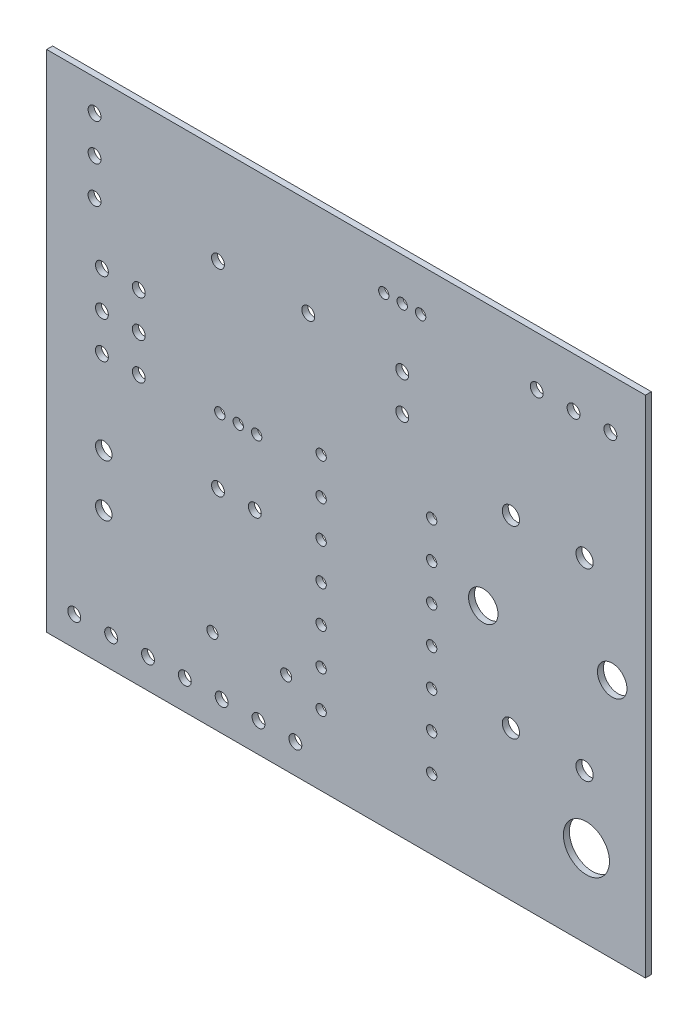
from build123d import *

# Parameters (mm, degrees)
SKETCH1_W           = 41.275
SKETCH1_H           = 34.798
SKETCH1_R           = 0.4445
SKETCH1_R_2         = 0.5969
SKETCH1_R_3         = 0.3556
SKETCH1_R_4         = 1.016
SKETCH1_R_5         = 1.5875
SKETCH1_R_6         = 0.381
SKETCH1_R_7         = 0.5715
BOSS_EXTRUDE1_DEPTH = 0.41148


with BuildPart() as part:
    # Sketch1 → Boss-Extrude1 (new body)
    with BuildSketch(Plane(origin=(0, 0, 0), x_dir=(-1, 0, 0), z_dir=(0, 0, -1))):
        with Locations((-20.6375, -17.399)):
            Rectangle(SKETCH1_W, SKETCH1_H)
        with Locations((-38.862, -3.429)):
            Circle(SKETCH1_R, mode=Mode.SUBTRACT)
        with Locations((-37.084, -11.811)):
            Circle(SKETCH1_R_2, mode=Mode.SUBTRACT)
        with Locations((-33.782, -3.429)):
            Circle(SKETCH1_R, mode=Mode.SUBTRACT)
        with Locations((-36.322, -3.429)):
            Circle(SKETCH1_R, mode=Mode.SUBTRACT)
        with Locations((-32.004, -11.811)):
            Circle(SKETCH1_R_2, mode=Mode.SUBTRACT)
        with Locations((-26.543, -14.732)):
            Circle(SKETCH1_R_3, mode=Mode.SUBTRACT)
        with Locations((-26.543, -17.272)):
            Circle(SKETCH1_R_3, mode=Mode.SUBTRACT)
        with Locations((-24.511, -2.921)):
            Circle(SKETCH1_R_3, mode=Mode.SUBTRACT)
        with Locations((-25.781, -2.921)):
            Circle(SKETCH1_R_3, mode=Mode.SUBTRACT)
        with Locations((-23.241, -2.921)):
            Circle(SKETCH1_R_3, mode=Mode.SUBTRACT)
        with Locations((-24.511, -6.985)):
            Circle(SKETCH1_R, mode=Mode.SUBTRACT)
        with Locations((-24.511, -9.525)):
            Circle(SKETCH1_R, mode=Mode.SUBTRACT)
        with Locations((-18.923, -14.732)):
            Circle(SKETCH1_R_3, mode=Mode.SUBTRACT)
        with Locations((-18.923, -17.272)):
            Circle(SKETCH1_R_3, mode=Mode.SUBTRACT)
        with Locations((-30.099, -18.161)):
            Circle(SKETCH1_R_4, mode=Mode.SUBTRACT)
        with Locations((-38.989, -18.161)):
            Circle(SKETCH1_R_4, mode=Mode.SUBTRACT)
        with Locations((-26.543, -19.812)):
            Circle(SKETCH1_R_3, mode=Mode.SUBTRACT)
        with Locations((-26.543, -22.352)):
            Circle(SKETCH1_R_3, mode=Mode.SUBTRACT)
        with Locations((-37.084, -24.511)):
            Circle(SKETCH1_R_2, mode=Mode.SUBTRACT)
        with Locations((-37.211, -29.083)):
            Circle(SKETCH1_R_5, mode=Mode.SUBTRACT)
        with Locations((-32.004, -24.511)):
            Circle(SKETCH1_R_2, mode=Mode.SUBTRACT)
        with Locations((-26.543, -24.892)):
            Circle(SKETCH1_R_3, mode=Mode.SUBTRACT)
        with Locations((-26.543, -27.432)):
            Circle(SKETCH1_R_3, mode=Mode.SUBTRACT)
        with Locations((-18.923, -19.812)):
            Circle(SKETCH1_R_3, mode=Mode.SUBTRACT)
        with Locations((-18.923, -22.352)):
            Circle(SKETCH1_R_3, mode=Mode.SUBTRACT)
        with Locations((-18.923, -27.432)):
            Circle(SKETCH1_R_3, mode=Mode.SUBTRACT)
        with Locations((-26.543, -29.972)):
            Circle(SKETCH1_R_3, mode=Mode.SUBTRACT)
        with Locations((-18.923, -29.972)):
            Circle(SKETCH1_R_3, mode=Mode.SUBTRACT)
        with Locations((-11.811, -6.731)):
            Circle(SKETCH1_R, mode=Mode.SUBTRACT)
        with Locations((-18.034, -6.731)):
            Circle(SKETCH1_R, mode=Mode.SUBTRACT)
        with Locations((-6.35, -11.176)):
            Circle(SKETCH1_R, mode=Mode.SUBTRACT)
        with Locations((-6.35, -13.716)):
            Circle(SKETCH1_R, mode=Mode.SUBTRACT)
        with Locations((-13.208, -15.748)):
            Circle(SKETCH1_R_3, mode=Mode.SUBTRACT)
        with Locations((-14.478, -15.748)):
            Circle(SKETCH1_R_3, mode=Mode.SUBTRACT)
        with Locations((-11.938, -15.748)):
            Circle(SKETCH1_R_3, mode=Mode.SUBTRACT)
        with Locations((-3.302, -7.239)):
            Circle(SKETCH1_R, mode=Mode.SUBTRACT)
        with Locations((-3.81, -11.176)):
            Circle(SKETCH1_R, mode=Mode.SUBTRACT)
        with Locations((-3.302, -2.159)):
            Circle(SKETCH1_R, mode=Mode.SUBTRACT)
        with Locations((-3.302, -4.699)):
            Circle(SKETCH1_R, mode=Mode.SUBTRACT)
        with Locations((-3.81, -13.716)):
            Circle(SKETCH1_R, mode=Mode.SUBTRACT)
        with Locations((-6.35, -16.256)):
            Circle(SKETCH1_R, mode=Mode.SUBTRACT)
        with Locations((-3.81, -16.256)):
            Circle(SKETCH1_R, mode=Mode.SUBTRACT)
        with Locations((-18.923, -24.892)):
            Circle(SKETCH1_R_3, mode=Mode.SUBTRACT)
        with Locations((-16.51, -29.083)):
            Circle(SKETCH1_R_6, mode=Mode.SUBTRACT)
        with Locations((-11.811, -20.32)):
            Circle(SKETCH1_R, mode=Mode.SUBTRACT)
        with Locations((-14.351, -20.32)):
            Circle(SKETCH1_R, mode=Mode.SUBTRACT)
        with Locations((-14.605, -32.766)):
            Circle(SKETCH1_R, mode=Mode.SUBTRACT)
        with Locations((-17.145, -32.766)):
            Circle(SKETCH1_R, mode=Mode.SUBTRACT)
        with Locations((-12.065, -32.766)):
            Circle(SKETCH1_R, mode=Mode.SUBTRACT)
        with Locations((-11.43, -29.083)):
            Circle(SKETCH1_R_6, mode=Mode.SUBTRACT)
        with Locations((-9.525, -32.766)):
            Circle(SKETCH1_R, mode=Mode.SUBTRACT)
        with Locations((-3.937, -21.971)):
            Circle(SKETCH1_R_7, mode=Mode.SUBTRACT)
        with Locations((-3.937, -25.5524)):
            Circle(SKETCH1_R_7, mode=Mode.SUBTRACT)
        with Locations((-4.445, -32.766)):
            Circle(SKETCH1_R, mode=Mode.SUBTRACT)
        with Locations((-6.985, -32.766)):
            Circle(SKETCH1_R, mode=Mode.SUBTRACT)
        with Locations((-1.905, -32.766)):
            Circle(SKETCH1_R, mode=Mode.SUBTRACT)
    extrude(amount=-BOSS_EXTRUDE1_DEPTH)


solid = part.part
